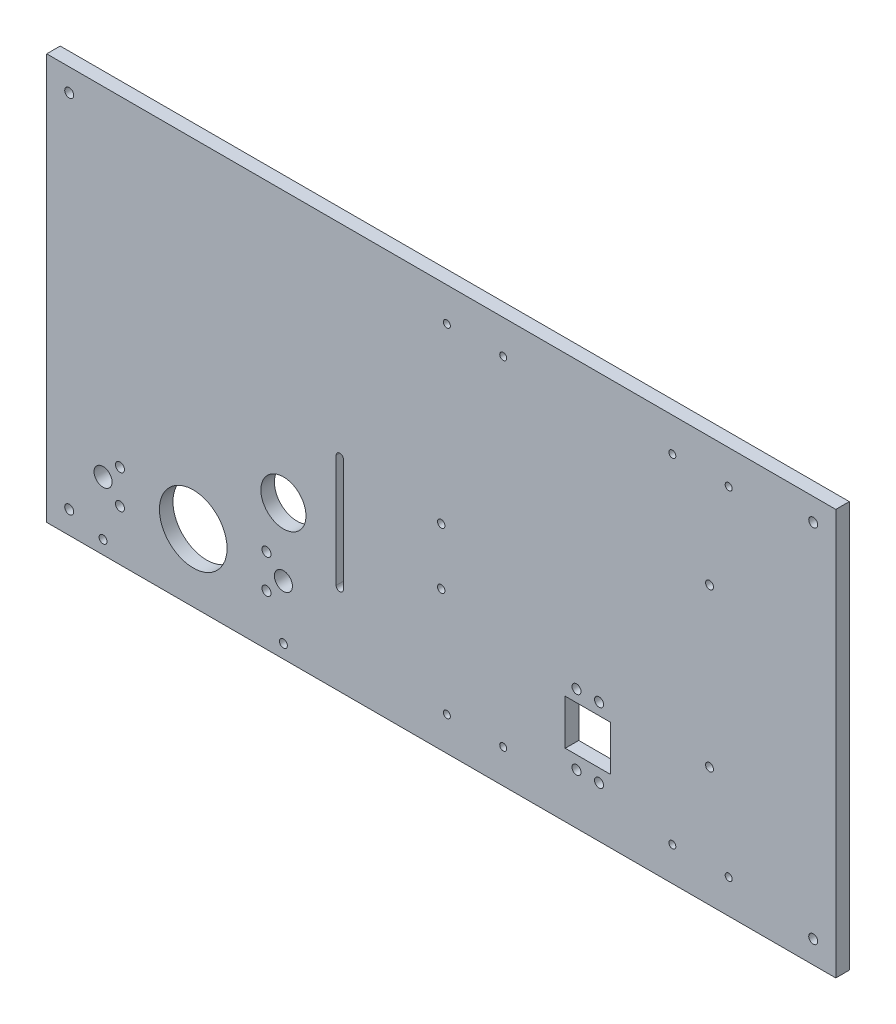
from build123d import *

# Parameters (mm, degrees)
ESBO_O1_W                = 350
ESBO_O1_H                = 180
ESBO_O1_R                = 2
ESBO_O1_R_2              = 4
ESBO_O1_R_3              = 15
ESBO_O1_R_4              = 1.65
ESBO_O1_W_2              = 20
ESBO_O1_H_2              = 20
RESSALTO_EXTRUS_O1_DEPTH = 6
ESBO_O2_R                = 2
ESPACADOR_DEPTH          = 10
ESBO_O3_R                = 2
CORTE_EXTRUS_O2_DEPTH    = 10
ESBO_O4_R                = 1.55
CORTE_EXTRUS_O3_DEPTH    = 10
ESBO_O5_R                = 10
FIOS_DEPTH               = 10
ESBO_O6_R                = 1.75
CORTE_EXTRUS_O5_DEPTH    = 10
ESBO_O7_R                = 1.75
CORTE_EXTRUS_O6_DEPTH    = 10
CORTE_EXTRUS_O7_DEPTH    = 10


with BuildPart() as part:
    # Esboço1 → Ressalto-extrusão1 (new body)
    with BuildSketch(Plane.XY):
        Rectangle(ESBO_O1_W, ESBO_O1_H)
        with Locations((-142.5, -67.5)):
            Circle(ESBO_O1_R, mode=Mode.SUBTRACT)
        with Locations((-150, -60)):
            Circle(ESBO_O1_R_2, mode=Mode.SUBTRACT)
        with Locations((-142.5, -52.5)):
            Circle(ESBO_O1_R, mode=Mode.SUBTRACT)
        with Locations((-110, -60)):
            Circle(ESBO_O1_R_3, mode=Mode.SUBTRACT)
        with Locations((-77.5, -67.5)):
            Circle(ESBO_O1_R, mode=Mode.SUBTRACT)
        with Locations((-70, -60)):
            Circle(ESBO_O1_R_2, mode=Mode.SUBTRACT)
        with Locations((-77.5, -52.5)):
            Circle(ESBO_O1_R, mode=Mode.SUBTRACT)
        with Locations((0, -28)):
            Circle(ESBO_O1_R_4, mode=Mode.SUBTRACT)
        with Locations((0, -3)):
            Circle(ESBO_O1_R_4, mode=Mode.SUBTRACT)
        with Locations((65, -51.75)):
            Rectangle(ESBO_O1_W_2, ESBO_O1_H_2, mode=Mode.SUBTRACT)
    extrude(amount=RESSALTO_EXTRUS_O1_DEPTH)

    # Esboço2 → espacador (cut)
    with BuildSketch(Plane.XY.offset(6)):
        with Locations((165, -80)):
            Circle(ESBO_O2_R)
        with Locations((165, 80)):
            Circle(ESBO_O2_R)
        with Locations((-165, 80)):
            Circle(ESBO_O2_R)
        with Locations((-165, -80)):
            Circle(ESBO_O2_R)
    extrude(amount=-ESPACADOR_DEPTH, mode=Mode.SUBTRACT)

    # Esboço3 → Corte-extrusão2 (cut)
    with BuildSketch(Plane.XY.offset(6)):
        with Locations((70, -67.5)):
            Circle(ESBO_O3_R)
        with Locations((70, -36.5)):
            Circle(ESBO_O3_R)
        with Locations((60, -36.5)):
            Circle(ESBO_O3_R)
        with Locations((60, -67.5)):
            Circle(ESBO_O3_R)
    extrude(amount=-CORTE_EXTRUS_O2_DEPTH, mode=Mode.SUBTRACT)

    # Esboço4 → Corte-extrusão3 (cut)
    with BuildSketch(Plane.XY.offset(6)):
        with Locations((102.5, 75)):
            Circle(ESBO_O4_R)
        with Locations((127.5, 75)):
            Circle(ESBO_O4_R)
        with Locations((2.5, 75)):
            Circle(ESBO_O4_R)
        with Locations((27.5, 75)):
            Circle(ESBO_O4_R)
        with Locations((127.5, -75)):
            Circle(ESBO_O4_R)
        with Locations((102.5, -75)):
            Circle(ESBO_O4_R)
        with Locations((2.5, -75)):
            Circle(ESBO_O4_R)
        with Locations((27.5, -75)):
            Circle(ESBO_O4_R)
    extrude(amount=-CORTE_EXTRUS_O3_DEPTH, mode=Mode.SUBTRACT)

    # Esboço5 → fios (cut)
    with BuildSketch(Plane.XY.offset(6)):
        with Locations((-70, -30)):
            Circle(ESBO_O5_R)
    extrude(amount=-FIOS_DEPTH, mode=Mode.SUBTRACT)

    # Esboço6 → Corte-extrusão5 (cut)
    with BuildSketch(Plane.XY.offset(6)):
        with Locations((119, -37)):
            Circle(ESBO_O6_R)
        with Locations((119, 33)):
            Circle(ESBO_O6_R)
    extrude(amount=-CORTE_EXTRUS_O5_DEPTH, mode=Mode.SUBTRACT)

    # Esboço7 → Corte-extrusão6 (cut)
    with BuildSketch(Plane.XY.offset(6)):
        with Locations((-70, -84)):
            Circle(ESBO_O7_R)
        with Locations((-150, -84)):
            Circle(ESBO_O7_R)
    extrude(amount=-CORTE_EXTRUS_O6_DEPTH, mode=Mode.SUBTRACT)

    # Esboço8 → Corte-extrusão7 (cut)
    with BuildSketch(Plane.XY.offset(6)):
        with BuildLine():
            Line((-46.6, -50), (-46.6, 0))
            ThreePointArc((-46.6, 0), (-45, 1.6), (-43.4, 0))
            Line((-43.4, 0), (-43.4, -50))
            ThreePointArc((-43.4, -50), (-45, -51.6), (-46.6, -50))
        make_face()
    extrude(amount=-CORTE_EXTRUS_O7_DEPTH, mode=Mode.SUBTRACT)


solid = part.part
